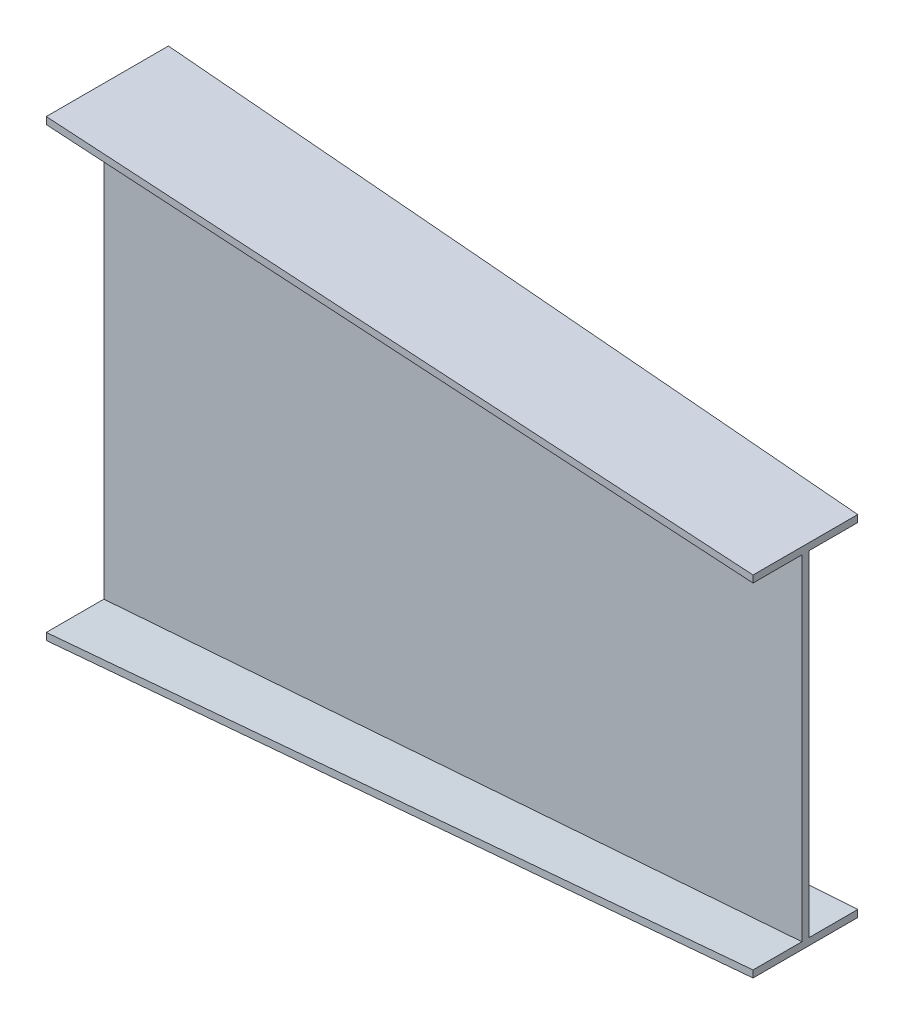
from build123d import *


with BuildPart() as part:
    # Sketch1 → Loft l2 section 0
    with BuildSketch(Plane(origin=(0, 0, 0), x_dir=(0, 0, -1), z_dir=(1, 0, 0))):
        with BuildLine():
            Line((-92.5, 325), (82.5, 325))
            Line((82.5, 325), (82.5, 315))
            Line((82.5, 315), (0, 315))
            Line((0, 315), (0, -315))
            Line((0, -315), (82.5, -315))
            Line((82.5, -315), (82.5, -325))
            Line((82.5, -325), (-92.5, -325))
            Line((-92.5, -325), (-92.5, -315))
            Line((-92.5, -315), (-10, -315))
            Line((-10, -315), (-10, 315))
            Line((-10, 315), (-92.5, 315))
            Line((-92.5, 315), (-92.5, 325))
        make_face()
    # Sketch4 → Loft l2 section 1
    with BuildSketch(Plane(origin=(1000, 0, -1000), x_dir=(0, 0, 1), z_dir=(-1, 0, 0))):
        with BuildLine():
            Line((930, 250), (1080, 250))
            Line((1080, 250), (1080, 240))
            Line((1080, 240), (1010, 240))
            Line((1010, 240), (1010, -240))
            Line((1010, -240), (1080, -240))
            Line((1080, -240), (1080, -250))
            Line((1080, -250), (930, -250))
            Line((930, -250), (930, -240))
            Line((930, -240), (1000, -240))
            Line((1000, -240), (1000, 240))
            Line((1000, 240), (930, 240))
            Line((930, 240), (930, 250))
        make_face()
    loft()


solid = part.part
